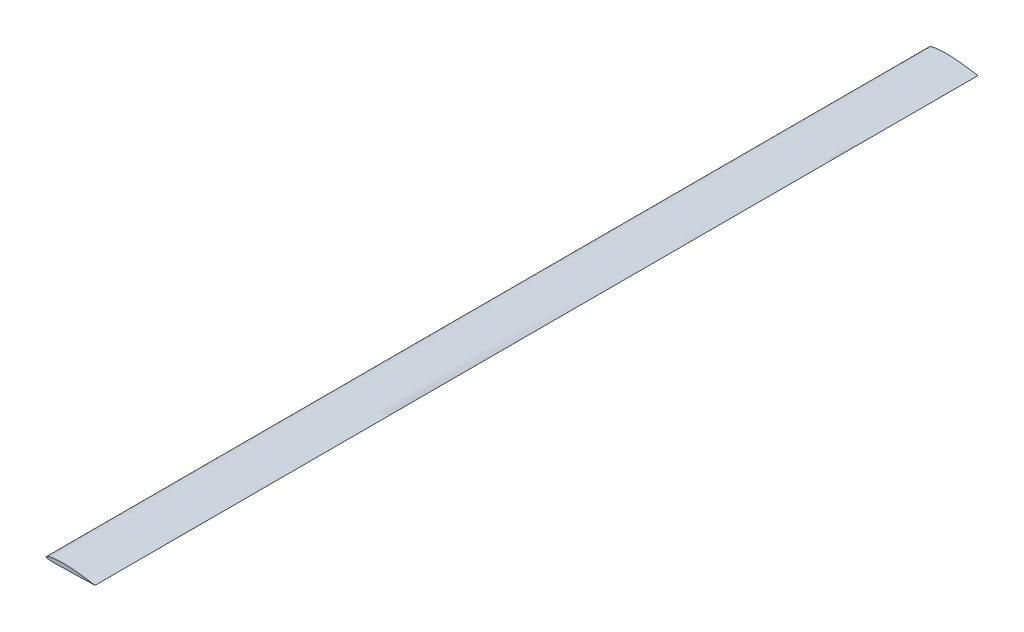
from build123d import *

# Parameters (mm, degrees)
BOSS_EXTRUDE1_DEPTH = 1800


with BuildPart() as part:
    # Sketch1 → Boss-Extrude1 (new body)
    with BuildSketch(Plane.XY):
        with BuildLine():
            add(Edge.make_bspline(
                [(100, 0), (100.000254641, 0.004845584), (99.304368018, 0.065917243), (98.602194416, 0.166377019), (96.918548009, 0.388906995), (94.882959291, 0.699750822), (92.267553215, 1.109728308), (89.230970093, 1.598621483), (85.784625506, 2.150171121), (81.991508296, 2.741960863), (77.895435059, 3.349338965), (73.540645911, 3.942231232), (68.967678492, 4.499522691), (64.217981973, 5.009680255), (59.33721716, 5.464479685), (54.377842329, 5.863564685), (49.394282953, 6.199245733), (44.437634279, 6.450310336), (39.556895274, 6.60960139), (34.799140518, 6.677534608), (30.208636358, 6.641921756), (25.827546213, 6.498459774), (21.695092828, 6.259238297), (17.849019413, 5.919154653), (14.322575687, 5.480857732), (11.143035012, 4.953429067), (8.33415766, 4.3478015), (5.915253903, 3.675251181), (3.900930283, 2.954526905), (2.297632946, 2.206091575), (1.117458692, 1.462157989), (0.456151921, 0.873206714), (0.179984342, 0.478870117), (0.08162915, 0.304427913), (0.020899686, 0.147654194), (-0.003086424, 0.024059813), (0.001743624, -0.073331826), (0.049440185, -0.160757084), (0.138835818, -0.260917631), (0.282100942, -0.377094962), (0.628837255, -0.592457482), (1.401022687, -0.907219246), (2.756187628, -1.256343307), (4.674914494, -1.575469512), (7.077934896, -1.83641871), (9.94833589, -2.030821633), (13.262418406, -2.15868704), (16.991220889, -2.221308928), (21.099338047, -2.223982463), (25.5455259, -2.173571095), (30.282881122, -2.077862804), (35.259698034, -1.944513684), (40.420676002, -1.781129419), (45.707640095, -1.595299131), (51.060576984, -1.393846441), (56.41812222, -1.184958105), (61.718081929, -0.975290493), (66.897999702, -0.773239464), (71.895683892, -0.584753469), (76.650033275, -0.416097546), (81.102008532, -0.27169971), (85.192790487, -0.156956037), (88.872110363, -0.072922602), (92.075504751, -0.018297162), (94.797963391, 0.008620562), (96.888108734, 0.019123581), (98.594495014, 0.008422548), (99.303002177, 0.017964204), (99.999745129, -0.00484996), (100, 0)],
                knots=[0, 0, 0, 0, 0.00163101, 0.006435235, 0.014220669, 0.024765625, 0.037826727, 0.053149348, 0.070473504, 0.089535694, 0.110075428, 0.131859875, 0.154692567, 0.178371256, 0.202679512, 0.227363961, 0.252132687, 0.276728351, 0.300939435, 0.324527111, 0.347267377, 0.368991726, 0.389507471, 0.40862838, 0.426224009, 0.442178728, 0.456395551, 0.468805124, 0.479372318, 0.488085518, 0.494967924, 0.50003381, 0.501035663, 0.50209449, 0.502996978, 0.50351288, 0.503955826, 0.504408894, 0.504955423, 0.505942626, 0.507129614, 0.510997735, 0.518231919, 0.527845532, 0.539808758, 0.554055915, 0.570489592, 0.588973674, 0.609342058, 0.631392897, 0.654894034, 0.679589725, 0.705203145, 0.731446604, 0.758020282, 0.784619628, 0.810935624, 0.836656653, 0.861473352, 0.885081475, 0.907187944, 0.927507338, 0.945765257, 0.961711874, 0.975121793, 0.985796266, 0.993581185, 0.998367518, 1, 1, 1, 1], degree=3))
        make_face()
    extrude(amount=BOSS_EXTRUDE1_DEPTH)


solid = part.part
